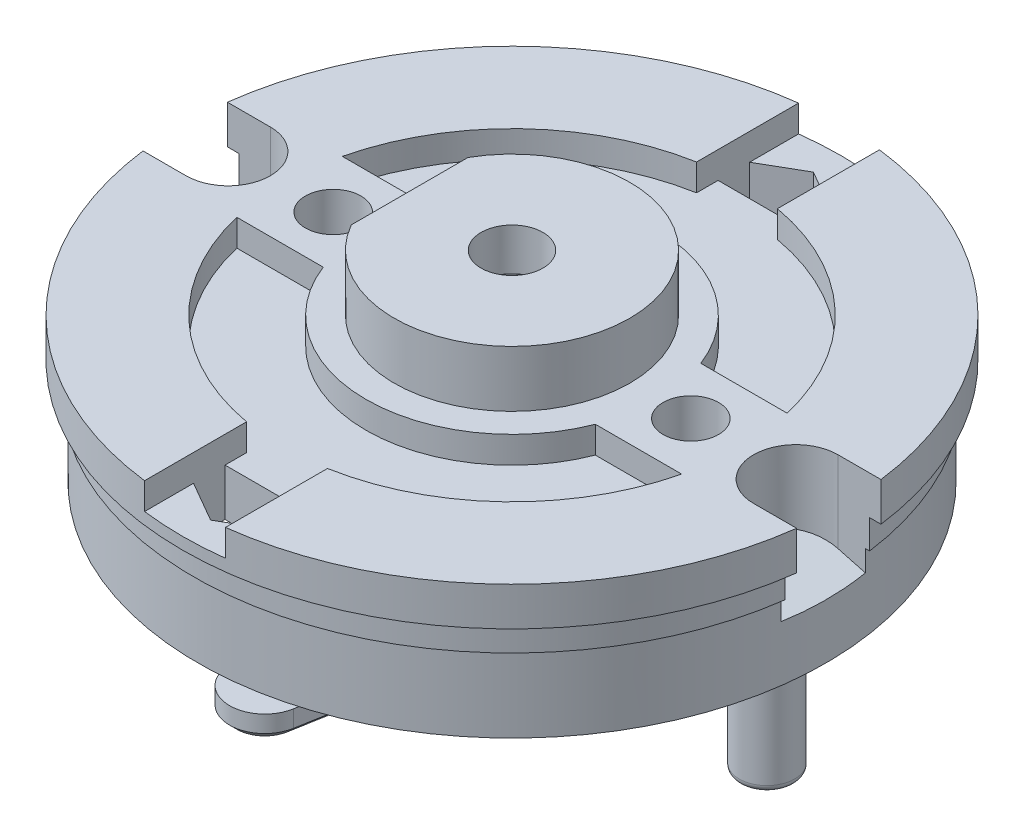
from build123d import *
from build123d.topology import SkipClean

# Parameters (mm, degrees)
SKETCH1_R                = 11.8999
BOSS_EXTRUDE1_DEPTH      = 5.207
BOSS_EXTRUDE2_DEPTH      = 2.032
CUT_EXTRUDE1_START       = -0.9652
CUT_EXTRUDE1_DEPTH       = 0.9652
CUT_EXTRUDE2_START       = -3.3528
CUT_EXTRUDE2_DEPTH       = 3.3528
DRAFT7_ANGLE             = -15
DRAFT8_ANGLE             = 15
CUT_EXTRUDE3_START       = -7.239
CUT_EXTRUDE3_OUTLINE_R   = 1.0033
CUT_EXTRUDE3_OUTLINE_R_2 = 1.1176
CUT_EXTRUDE3_DEPTH       = 7.239
SKETCH8_R                = 11.8999
SKETCH8_R_2              = 11.4935
SKETCH8_R_3              = 11.3411
CUT_EXTRUDE4_DEPTH       = 2.7686
SKETCH8_3_R              = 11.8999
SKETCH8_3_R_2            = 11.4935
CUT_EXTRUDE5_DEPTH       = 3.81
BOSS_EXTRUDE12_START     = 1.651
BOSS_EXTRUDE12_DEPTH     = 1.651
SKETCH11_R               = 1.0033
CUT_EXTRUDE6_DEPTH       = 2.54
SKETCH12_R               = 0.7493
BOSS_EXTRUDE13_DEPTH     = 3.556
BOSS_EXTRUDE14_DEPTH     = 5.3086
CUT_EXTRUDE7_DEPTH       = 4.445
SKETCH15_R               = 0.5715
BOSS_EXTRUDE15_DEPTH     = 1.778
SKETCH16_R               = 3.0099
CUT_EXTRUDE8_DEPTH       = 3.175
SKETCH17_R               = 4.0005
CUT_EXTRUDE9_DEPTH       = 0.635
SKETCH18_R               = 1.0033
BOSS_EXTRUDE16_DEPTH     = 4.445
BOSS_EXTRUDE17_DEPTH     = 2.54
SKETCH22_R               = 0.634567006
BOSS_EXTRUDE18_DEPTH     = 1.905
FILLET1_R                = 0.254
CHAMFER1_SIZE            = 0.254
BOSS_EXTRUDE19_START     = 2.54
BOSS_EXTRUDE19_DEPTH     = 2.54
CIRPATTERN1_COUNT        = 2
CIRPATTERN1_START        = 2.54
CIRPATTERN1_COPY_1_DEPTH = 2.54


# Read off the part's stored shape, not the designer's step: Cut-Extrude3
with BuildPart() as part:
    # Sketch1 → Boss-Extrude1 (new body)
    with BuildSketch(Plane(origin=(0, 0, 0), x_dir=(1, 0, 0), z_dir=(0, 1, 0))):
        with Locations(Location((0, 0, 0), (0, 0, 270))):
            Circle(SKETCH1_R)
    extrude(amount=BOSS_EXTRUDE1_DEPTH)

    # Sketch2 → Boss-Extrude2 (add)
    with BuildSketch(Plane(origin=(0, 5.207, 0), x_dir=(1, 0, 0), z_dir=(0, 1, 0))):
        with BuildLine():
            ThreePointArc((4.2545, 0), (1.090278542, 4.112427866), (-3.6957, 2.107740914))
            Line((-3.6957, 2.107740914), (-3.6957, -2.107740914))
            ThreePointArc((-3.6957, -2.107740914), (1.090278542, -4.112427866), (4.2545, 0))
        make_face()
    extrude(amount=BOSS_EXTRUDE2_DEPTH)

    # Sketch4 → Cut-Extrude1 (cut)
    with BuildSketch(Plane(origin=(0, 5.207, 0), x_dir=(1, 0, 0), z_dir=(0, 1, 0)).offset(CUT_EXTRUDE1_START)):
        with BuildLine():
            ThreePointArc((-1.4605, 8.124774751), (0, 8.255), (1.4605, 8.124774751))
            Line((1.4605, 8.124774751), (1.4605, 11.809934791))
            ThreePointArc((1.4605, 11.809934791), (0, 11.8999), (-1.4605, 11.809934791))
            Line((-1.4605, 11.809934791), (-1.4605, 8.124774751))
        make_face()
        with BuildLine():
            ThreePointArc((-1.4605, 5.064100117), (0, 5.2705), (1.4605, 5.064100117))
            Line((1.4605, 5.064100117), (1.4605, 8.124774751))
            ThreePointArc((1.4605, 8.124774751), (0, 8.255), (-1.4605, 8.124774751))
            Line((-1.4605, 8.124774751), (-1.4605, 5.064100117))
        make_face()
        with BuildLine():
            ThreePointArc((1.4605, 5.064100117), (3.557261339, 3.888966703), (4.914177983, 1.905))
            Line((4.914177983, 1.905), (8.032185257, 1.905))
            ThreePointArc((8.032185257, 1.905), (5.674431058, 5.995486399), (1.4605, 8.124774751))
            Line((1.4605, 8.124774751), (1.4605, 5.064100117))
        make_face()
        with BuildLine():
            ThreePointArc((-4.914177983, 1.905), (-3.557261339, 3.888966703), (-1.4605, 5.064100117))
            Line((-1.4605, 5.064100117), (-1.4605, 8.124774751))
            ThreePointArc((-1.4605, 8.124774751), (-5.674431058, 5.995486399), (-8.032185257, 1.905))
            Line((-8.032185257, 1.905), (-4.914177983, 1.905))
        make_face()
        with BuildLine():
            Line((-1.4605, -8.124774751), (-1.4605, -5.064100117))
            ThreePointArc((-1.4605, -5.064100117), (-3.557261339, -3.888966703), (-4.914177983, -1.905))
            Line((-4.914177983, -1.905), (-8.032185257, -1.905))
            ThreePointArc((-8.032185257, -1.905), (-5.674431058, -5.995486399), (-1.4605, -8.124774751))
        make_face()
        with BuildLine():
            Line((8.032185257, -1.905), (4.914177983, -1.905))
            ThreePointArc((4.914177983, -1.905), (3.557261339, -3.888966703), (1.4605, -5.064100117))
            Line((1.4605, -5.064100117), (1.4605, -8.124774751))
            ThreePointArc((1.4605, -8.124774751), (5.674431058, -5.995486399), (8.032185257, -1.905))
        make_face()
        with BuildLine():
            Line((1.4605, -8.124774751), (1.4605, -5.064100117))
            ThreePointArc((1.4605, -5.064100117), (0, -5.2705), (-1.4605, -5.064100117))
            Line((-1.4605, -5.064100117), (-1.4605, -8.124774751))
            ThreePointArc((-1.4605, -8.124774751), (0, -8.255), (1.4605, -8.124774751))
        make_face()
        with BuildLine():
            Line((1.4605, -11.809934791), (1.4605, -8.124774751))
            ThreePointArc((1.4605, -8.124774751), (0, -8.255), (-1.4605, -8.124774751))
            Line((-1.4605, -8.124774751), (-1.4605, -11.809934791))
            ThreePointArc((-1.4605, -11.809934791), (0, -11.8999), (1.4605, -11.809934791))
        make_face()
    extrude(amount=CUT_EXTRUDE1_DEPTH, mode=Mode.SUBTRACT)

    # Sketch5 → Cut-Extrude2 (cut)
    with BuildSketch(Plane(origin=(0, 5.207, 0), x_dir=(1, 0, 0), z_dir=(0, 1, 0)).offset(CUT_EXTRUDE2_START)):
        with BuildLine():
            Line((11.80190849, 1.524), (10.2489, 1.524))
            ThreePointArc((10.2489, 1.524), (8.7249, 0), (10.2489, -1.524))
            Line((10.2489, -1.524), (11.80190849, -1.524))
            ThreePointArc((11.80190849, -1.524), (11.8999, 0), (11.80190849, 1.524))
        make_face()
        with BuildLine():
            Line((-11.80190849, 1.524), (-10.2489, 1.524))
            ThreePointArc((-10.2489, 1.524), (-8.7249, 0), (-10.2489, -1.524))
            Line((-10.2489, -1.524), (-11.80190849, -1.524))
            ThreePointArc((-11.80190849, -1.524), (-11.8999, 0), (-11.80190849, 1.524))
        make_face()
    extrude(amount=CUT_EXTRUDE2_DEPTH, mode=Mode.SUBTRACT)

    # Draft7
    draft7_faces = [part.faces().sort_by_distance(p)[0] for p in [
        (10.439224502, 1.8542, 0),
    ]]
    draft(draft7_faces, Plane(origin=(11.80190849, 0, 0), x_dir=(0, 0, -1), z_dir=(-1, 0, 0)), DRAFT7_ANGLE)

    # Draft8
    draft8_faces = [part.faces().sort_by_distance(p)[0] for p in [
        (-10.439224502, 1.8542, 0),
    ]]
    draft(draft8_faces, Plane(origin=(-11.80190849, 0, 0), x_dir=(0, 0, -1), z_dir=(-1, 0, 0)), DRAFT8_ANGLE)

    # Cut-Extrude3 outline → Cut-Extrude3 (cut)
    with BuildSketch(Plane(origin=(0, 7.239, 0), x_dir=(1, 0, 0), z_dir=(0, 1, 0)).offset(CUT_EXTRUDE3_START)):
        Polygon((0, 10.8839), (-1.4605, 10.040679932), (-1.4605, 8.9027), (1.4605, 8.9027), (1.4605, 10.040679932), align=None)
        Polygon((-1.4605, -8.9027), (-1.4605, -10.040679932), (0, -10.8839), (1.4605, -10.040679932), (1.4605, -8.9027), align=None)
        with Locations((6.45795, 0)):
            Circle(CUT_EXTRUDE3_OUTLINE_R)
        Circle(CUT_EXTRUDE3_OUTLINE_R_2)
        with Locations((-6.45795, 0)):
            Circle(CUT_EXTRUDE3_OUTLINE_R)
    extrude(amount=CUT_EXTRUDE3_DEPTH, mode=Mode.SUBTRACT)

    # Sketch8 → Cut-Extrude4 (cut)
    # profile 1 of 2: a face of its own
    with BuildSketch(Plane.XZ):
        Circle(SKETCH8_R)
        Circle(SKETCH8_R_2, mode=Mode.SUBTRACT)
    # profile 2 of 2: a face of its own
    with BuildSketch(Plane.XZ):
        Circle(SKETCH8_R_2)
        with Locations(Location((0, 0, 0), (0, 0, 270))):
            Circle(SKETCH8_R_3, mode=Mode.SUBTRACT)
    extrude(amount=-CUT_EXTRUDE4_DEPTH, mode=Mode.SUBTRACT)

    # Sketch8<3> → Cut-Extrude5 (cut)
    with BuildSketch(Plane.XZ):
        Circle(SKETCH8_3_R)
        Circle(SKETCH8_3_R_2, mode=Mode.SUBTRACT)
    extrude(amount=-CUT_EXTRUDE5_DEPTH, mode=Mode.SUBTRACT)

    # Sketch10 → Boss-Extrude12 (add)
    with SkipClean():  # the faces are left unmerged after this step: merging them gives an invalid solid
        with BuildSketch(Plane.XZ.offset(-3.81).offset(BOSS_EXTRUDE12_START)):
            with BuildLine():
                Line((-1.27, -11.423118762), (-1.27, -11.831936444))
                ThreePointArc((-1.27, -11.831936444), (0, -11.8999), (1.27, -11.831936444))
                Line((1.27, -11.831936444), (1.27, -11.423118762))
                ThreePointArc((1.27, -11.423118762), (0, -11.4935), (-1.27, -11.423118762))
            make_face()
        extrude(amount=-BOSS_EXTRUDE12_DEPTH)

    # Sketch11 → Cut-Extrude6 (cut)
    # profile 1 of 8: a face of its own
    with SkipClean():  # the faces are left unmerged after this step: merging them gives an invalid solid
        with BuildSketch(Plane.XZ):
            with BuildLine():
                Line((-7.5311, 3.175), (3.175, 3.175))
                Line((3.175, 3.175), (6.096, 6.096))
                Line((6.096, 6.096), (6.096, 7.304459977))
                ThreePointArc((6.096, 7.304459977), (6.134669197, 7.498863161), (6.244789755, 7.663670222))
                Line((6.244789755, 7.663670222), (6.556957743, 7.975838211))
                ThreePointArc((6.556957743, 7.975838211), (3.978888118, 9.527651303), (1.062877501, 10.270247389))
                Line((1.062877501, 10.270247389), (1.4605, 10.040679932))
                Line((1.4605, 10.040679932), (1.4605, 8.9027))
                Line((1.4605, 8.9027), (-1.4605, 8.9027))
                Line((-1.4605, 8.9027), (-1.4605, 10.040679932))
                Line((-1.4605, 10.040679932), (-1.062877501, 10.270247389))
                ThreePointArc((-1.062877501, 10.270247389), (-4.586418908, 9.250537909), (-7.5311, 7.063301126))
                Line((-7.5311, 7.063301126), (-7.5311, 3.175))
            make_face()
        # profile 2 of 8: a face of its own
        with BuildSketch(Plane.XZ):
            with BuildLine():
                Line((3.175, 3.175), (7.5311, 3.175))
                Line((7.5311, 3.175), (7.5311, 6.112219533))
                Line((7.5311, 6.112219533), (6.963210245, 5.544329778))
                ThreePointArc((6.963210245, 5.544329778), (6.409596816, 5.43420922), (6.096, 5.903540023))
                Line((6.096, 5.903540023), (6.096, 6.096))
                Line((6.096, 6.096), (3.175, 3.175))
            make_face()
        # profile 3 of 8: a face of its own
        with BuildSketch(Plane.XZ):
            with BuildLine():
                Line((7.5311, 6.112219533), (7.5311, 3.175))
                Line((7.5311, 3.175), (9.824818828, 3.175))
                ThreePointArc((9.824818828, 3.175), (9.059539574, 4.953022583), (7.975838211, 6.556957743))
                Line((7.975838211, 6.556957743), (7.5311, 6.112219533))
            make_face()
        # profile 4 of 8: a face of its own
        with BuildSketch(Plane.XZ):
            with BuildLine():
                Line((7.5311, 3.175), (7.5311, 0))
                ThreePointArc((7.5311, 0), (8.164514418, 1.958428647), (9.824818828, 3.175))
                Line((9.824818828, 3.175), (7.5311, 3.175))
            make_face()
        # profile 5 of 8: a face of its own
        with BuildSketch(Plane.XZ):
            with BuildLine():
                ThreePointArc((9.824818828, -3.175), (8.164514418, -1.958428647), (7.5311, 0))
                Line((7.5311, 0), (7.5311, 3.175))
                Line((7.5311, 3.175), (3.175, 3.175))
                Line((3.175, 3.175), (-7.5311, 3.175))
                Line((-7.5311, 3.175), (-7.5311, 0))
                ThreePointArc((-7.5311, 0), (-8.164514418, -1.958428647), (-9.824818828, -3.175))
                Line((-9.824818828, -3.175), (9.824818828, -3.175))
            make_face()
            with Locations(Location((-6.45795, 0, 0), (0, 0, 90))):
                Circle(SKETCH11_R, mode=Mode.SUBTRACT)
            with BuildLine():
                ThreePointArc((1.1176, 0), (-1.032527766, -0.427687004), (0.790262539, 0.790262539))
                ThreePointArc((0.790262539, 0.790262539), (1.032527766, 0.427687004), (1.1176, 0))
            make_face(mode=Mode.SUBTRACT)
            with Locations(Location((6.45795, 0, 0), (0, 0, 90))):
                Circle(SKETCH11_R, mode=Mode.SUBTRACT)
        # profile 6 of 8: a face of its own
        with BuildSketch(Plane.XZ):
            with BuildLine():
                ThreePointArc((1.062877501, -10.270247389), (6.497777829, -8.024124457), (9.824818828, -3.175))
                Line((9.824818828, -3.175), (-9.824818828, -3.175))
                ThreePointArc((-9.824818828, -3.175), (-9.059539574, -4.953022583), (-7.975838211, -6.556957743))
                Line((-7.975838211, -6.556957743), (-6.963210245, -5.544329778))
                ThreePointArc((-6.963210245, -5.544329778), (-6.409596816, -5.43420922), (-6.096, -5.903540023))
                Line((-6.096, -5.903540023), (-6.096, -7.304459977))
                ThreePointArc((-6.096, -7.304459977), (-6.134669197, -7.498863161), (-6.244789755, -7.663670222))
                Line((-6.244789755, -7.663670222), (-6.556957743, -7.975838211))
                ThreePointArc((-6.556957743, -7.975838211), (-3.978888118, -9.527651303), (-1.062877501, -10.270247389))
                Line((-1.062877501, -10.270247389), (-1.4605, -10.040679932))
                Line((-1.4605, -10.040679932), (-1.4605, -8.9027))
                Line((-1.4605, -8.9027), (1.4605, -8.9027))
                Line((1.4605, -8.9027), (1.4605, -10.040679932))
                Line((1.4605, -10.040679932), (1.062877501, -10.270247389))
            make_face()
        # profile 7 of 8: a face of its own
        with BuildSketch(Plane.XZ):
            with BuildLine():
                Line((-7.5311, 0), (-7.5311, 3.175))
                Line((-7.5311, 3.175), (-9.824818828, 3.175))
                ThreePointArc((-9.824818828, 3.175), (-8.164514418, 1.958428647), (-7.5311, 0))
            make_face()
        # profile 8 of 8: a face of its own
        with BuildSketch(Plane.XZ):
            with BuildLine():
                Line((-9.824818828, 3.175), (-7.5311, 3.175))
                Line((-7.5311, 3.175), (-7.5311, 7.063301126))
                ThreePointArc((-7.5311, 7.063301126), (-8.893070393, 5.246045082), (-9.824818828, 3.175))
            make_face()
        extrude(amount=-CUT_EXTRUDE6_DEPTH, mode=Mode.SUBTRACT)

    # Sketch12 → Boss-Extrude13 (add)
    with SkipClean():  # the faces are left unmerged after this step: merging them gives an invalid solid
        with BuildSketch(Plane.XZ.offset(-2.54)):
            with Locations(Location((2.794, 5.702285857, 0), (0, 0, 270))):
                Circle(SKETCH12_R)
            with Locations(Location((-2.794, -5.702285857, 0), (0, 0, 270))):
                Circle(SKETCH12_R)
        extrude(amount=BOSS_EXTRUDE13_DEPTH)

    # Sketch13 → Boss-Extrude14 (add)
    with SkipClean():  # the faces are left unmerged after this step: merging them gives an invalid solid
        with BuildSketch(Plane.XZ.offset(-2.54)):
            with BuildLine():
                Line((-0.977244696, 7.15742919), (-1.250705846, 8.708304439))
                ThreePointArc((-1.250705846, 8.708304439), (-0.220533186, 10.179543471), (1.250705846, 9.14937081))
                Line((1.250705846, 9.14937081), (1.524166997, 7.598495561))
                ThreePointArc((1.524166997, 7.598495561), (0.493994336, 6.127256529), (-0.977244696, 7.15742919))
            make_face()
            with BuildLine():
                Line((0.977244696, -7.15742919), (1.250705846, -8.708304439))
                ThreePointArc((1.250705846, -8.708304439), (0.220533186, -10.179543471), (-1.250705846, -9.14937081))
                Line((-1.250705846, -9.14937081), (-1.524166997, -7.598495561))
                ThreePointArc((-1.524166997, -7.598495561), (-0.493994336, -6.127256529), (0.977244696, -7.15742919))
            make_face()
        extrude(amount=BOSS_EXTRUDE14_DEPTH)

    # Sketch14 → Cut-Extrude7 (cut)
    with SkipClean():  # the faces are left unmerged after this step: merging them gives an invalid solid
        with BuildSketch(Plane(origin=(0, 2.54, 0), x_dir=(1, 0, 0), z_dir=(0, 1, 0))):
            with BuildLine():
                Line((1.294200566, -8.9027), (-1.269731005, -8.9027))
                ThreePointArc((-1.269731005, -8.9027), (0.01223478, -10.369082891), (1.294200566, -8.9027))
            make_face()
            with BuildLine():
                Line((-1.294200566, 8.9027), (1.269731005, 8.9027))
                ThreePointArc((1.269731005, 8.9027), (-0.01223478, 10.353202982), (-1.294200566, 8.9027))
            make_face()
        extrude(amount=-CUT_EXTRUDE7_DEPTH, mode=Mode.SUBTRACT)

    # Sketch15 → Boss-Extrude15 (add)
    with SkipClean():  # the faces are left unmerged after this step: merging them gives an invalid solid
        with BuildSketch(Plane.XZ.offset(-2.54)):
            with Locations(Location((-5.702285857, 2.794, 0), (0, 0, 270))):
                Circle(SKETCH15_R)
            with Locations(Location((5.702285857, -2.794, 0), (0, 0, 270))):
                Circle(SKETCH15_R)
        extrude(amount=BOSS_EXTRUDE15_DEPTH)

    # Sketch16 → Cut-Extrude8 (cut)
    with SkipClean():  # the faces are left unmerged after this step: merging them gives an invalid solid
        with BuildSketch(Plane.XZ.offset(-2.54)):
            with Locations(Location((0, 0, 0), (0, 0, 270))):
                Circle(SKETCH16_R)
        extrude(amount=-CUT_EXTRUDE8_DEPTH, mode=Mode.SUBTRACT)

    # Sketch17 → Cut-Extrude9 (cut)
    with SkipClean():  # the faces are left unmerged after this step: merging them gives an invalid solid
        with BuildSketch(Plane.XZ.offset(-2.54)):
            with Locations(Location((0, 0, 0), (0, 0, 270))):
                Circle(SKETCH17_R)
        extrude(amount=-CUT_EXTRUDE9_DEPTH, mode=Mode.SUBTRACT)

    # Sketch18 → Boss-Extrude16 (add)
    with SkipClean():  # the faces are left unmerged after this step: merging them gives an invalid solid
        with BuildSketch(Plane.XZ):
            with Locations(Location((-9.2075, 0, 0), (0, 0, 90))):
                Circle(SKETCH18_R)
            with Locations(Location((9.2075, 0, 0), (0, 0, 90))):
                Circle(SKETCH18_R)
        extrude(amount=BOSS_EXTRUDE16_DEPTH)

    # Sketch19 → Boss-Extrude17 (add)
    with SkipClean():  # the faces are left unmerged after this step: merging them gives an invalid solid
        with BuildSketch(Plane.XZ.offset(-5.715)):
            with BuildLine():
                Line((0.635, 1.863267895), (0.989202919, 2.476765347))
                ThreePointArc((0.989202919, 2.476765347), (0, 2.667), (-0.989202919, 2.476765347))
                Line((-0.989202919, 2.476765347), (-0.635, 1.863267895))
                ThreePointArc((-0.635, 1.863267895), (0, 1.9685), (0.635, 1.863267895))
            make_face()
            with BuildLine():
                Line((1.931137331, 0.381707816), (2.639543169, 0.381707816))
                ThreePointArc((2.639543169, 0.381707816), (2.309689752, 1.3335), (1.65034025, 2.095057531))
                Line((1.65034025, 2.095057531), (1.296137331, 1.481560079))
                ThreePointArc((1.296137331, 1.481560079), (1.704771007, 0.98425), (1.931137331, 0.381707816))
            make_face()
            with BuildLine():
                Line((1.296137331, -1.481560079), (1.65034025, -2.095057531))
                ThreePointArc((1.65034025, -2.095057531), (2.309689752, -1.3335), (2.639543169, -0.381707816))
                Line((2.639543169, -0.381707816), (1.931137331, -0.381707816))
                ThreePointArc((1.931137331, -0.381707816), (1.704771007, -0.98425), (1.296137331, -1.481560079))
            make_face()
            with BuildLine():
                Line((-1.296137331, 1.481560079), (-1.65034025, 2.095057531))
                ThreePointArc((-1.65034025, 2.095057531), (-2.309689752, 1.3335), (-2.639543169, 0.381707816))
                Line((-2.639543169, 0.381707816), (-1.931137331, 0.381707816))
                ThreePointArc((-1.931137331, 0.381707816), (-1.704771007, 0.98425), (-1.296137331, 1.481560079))
            make_face()
            with BuildLine():
                Line((-0.635, -1.863267895), (-0.989202919, -2.476765347))
                ThreePointArc((-0.989202919, -2.476765347), (0, -2.667), (0.989202919, -2.476765347))
                Line((0.989202919, -2.476765347), (0.635, -1.863267895))
                ThreePointArc((0.635, -1.863267895), (0, -1.9685), (-0.635, -1.863267895))
            make_face()
            with BuildLine():
                Line((-1.931137331, -0.381707816), (-2.639543169, -0.381707816))
                ThreePointArc((-2.639543169, -0.381707816), (-2.309689752, -1.3335), (-1.65034025, -2.095057531))
                Line((-1.65034025, -2.095057531), (-1.296137331, -1.481560079))
                ThreePointArc((-1.296137331, -1.481560079), (-1.704771007, -0.98425), (-1.931137331, -0.381707816))
            make_face()
        extrude(amount=BOSS_EXTRUDE17_DEPTH)

    # Sketch21 → Cut-Revolve3 (revolve, cut)
    with SkipClean():  # the faces are left unmerged after this step: merging them gives an invalid solid
        with BuildSketch(Plane(origin=(0, 0, 0), x_dir=(-0.500000000000001, 0, -0.8660254037844382), z_dir=(0.866025403784438, 0, -0.5000000000000009)), mode=Mode.PRIVATE) as cut_revolve3_sk:
            with BuildLine():
                Line((-1.931137331, 5.33600053), (-1.931137331, 3.17700053))
                ThreePointArc((-1.931137331, 3.17700053), (-1.9939, 4.25650053), (-1.931137331, 5.33600053))
            make_face()
            with BuildLine():
                Line((-1.931137331, 3.17700053), (-1.931137331, 5.33600053))
                ThreePointArc((-1.931137331, 5.33600053), (-1.9939, 4.25650053), (-1.931137331, 3.17700053))
            make_face()
        revolve(cut_revolve3_sk.sketch.rotate(Axis((0, 5.715, 0), (0, 1, 0)), 330), axis=Axis((0, 5.715, 0), (0, 1, 0)), mode=Mode.SUBTRACT)

    # Sketch22 → Boss-Extrude18 (add)
    with SkipClean():  # the faces are left unmerged after this step: merging them gives an invalid solid
        with BuildSketch(Plane.XZ.offset(2.7686)):
            with Locations(Location((0, -8.928837625, 0), (0, 0, 270))):
                Circle(SKETCH22_R)
        extrude(amount=BOSS_EXTRUDE18_DEPTH)

    # Fillet1
    fillet1_edges = [part.edges().sort_by_distance(p)[0] for p in [
        (-9.2075, -4.445, -1.0033),
        (9.2075, -4.445, -1.0033),
        (0, -4.6736, -8.294270619),
    ]]
    fillet(fillet1_edges, radius=FILLET1_R)

    # Chamfer1
    chamfer1_edges = [part.edges().sort_by_distance(p)[0] for p in [
        (0.493994336, -2.7686, 6.127256529),
        (1.387436421, -2.7686, 8.373933186),
        (-0.220533186, -2.7686, 10.179543471),
        (-1.113975271, -2.7686, 7.932866814),
        (-0.493994336, -2.7686, -6.127256529),
        (-1.387436421, -2.7686, -8.373933186),
        (0.220533186, -2.7686, -10.179543471),
        (1.113975271, -2.7686, -7.932866814),
    ]]
    chamfer(chamfer1_edges, length=CHAMFER1_SIZE)

    # Sketch23 → Boss-Extrude19 (add)
    with SkipClean():  # the faces are left unmerged after this step: merging them gives an invalid solid
        with BuildSketch(Plane.XZ.offset(-2.54).offset(BOSS_EXTRUDE19_START)):
            with BuildLine():
                ThreePointArc((1.465602072, 10.220552851), (2.037397783, 9.562985678), (2.908056036, 9.526942231))
                ThreePointArc((2.908056036, 9.526942231), (3.09444966, 9.638269067), (3.232061328, 9.806195469))
                ThreePointArc((3.232061328, 9.806195469), (2.357951094, 10.052251322), (1.465602072, 10.220552851))
            make_face()
        boss_extrude19 = extrude(amount=-BOSS_EXTRUDE19_DEPTH)

    # Mirror1: Boss-Extrude19 across plane
    with SkipClean():  # the faces are left unmerged after this step: merging them gives an invalid solid
        add(boss_extrude19.mirror(Plane(origin=(0, 0, 0), x_dir=(0, 0, 1), z_dir=(1, 0, 0))))

    # CirPattern1: Boss-Extrude19 ×2 about axis
    with SkipClean():  # the faces are left unmerged after this step: merging them gives an invalid solid
        cirpattern1_axis = Axis((0, 0, 0), (0, 1, 0))
        for i in range(1, CIRPATTERN1_COUNT):
            add(boss_extrude19.rotate(cirpattern1_axis, i * 360 / CIRPATTERN1_COUNT))

    # CirPattern1 copy 1 sketch → CirPattern1 copy 1 (add)
    with SkipClean():  # the faces are left unmerged after this step: merging them gives an invalid solid
        with BuildSketch(Plane.XZ.offset(-2.54).offset(CIRPATTERN1_START)):
            with BuildLine():
                ThreePointArc((1.465602072, -10.220552851), (2.037397783, -9.562985678), (2.908056036, -9.526942231))
                ThreePointArc((2.908056036, -9.526942231), (3.09444966, -9.638269067), (3.232061328, -9.806195469))
                ThreePointArc((3.232061328, -9.806195469), (2.357951094, -10.052251322), (1.465602072, -10.220552851))
            make_face()
        extrude(amount=-CIRPATTERN1_COPY_1_DEPTH)


solid = part.part
